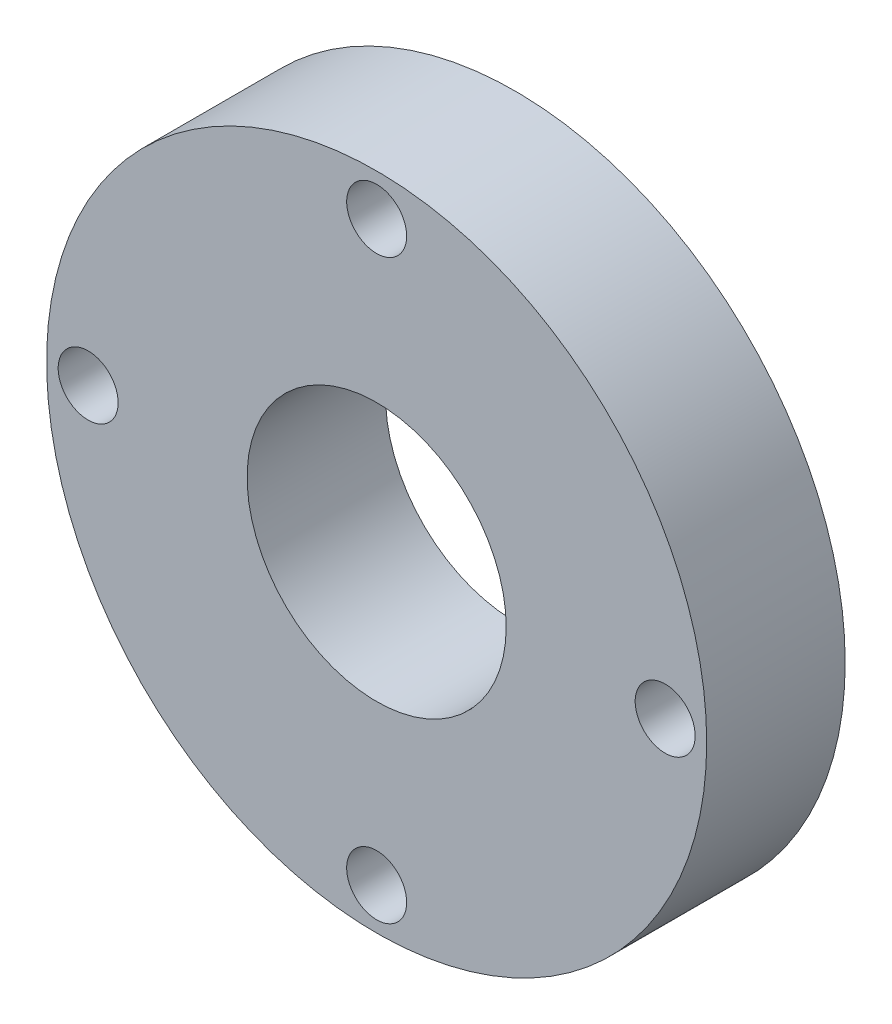
from build123d import *

# Parameters (mm, degrees)
SKETCH1_W            = 15.24
SKETCH1_H            = 26.797
SKETCH5_R            = 14.25575
SEAL_SEAT_DEPTH      = 54.58015461
M6_CLEARANCE_HOLE1_D = 6.6
CIRPATTERN1_COUNT    = 4


with BuildPart() as part:
    # Sketch1 → Main_body (revolve)
    with BuildSketch(Plane(origin=(0, 0, 0), x_dir=(0, 0, -1), z_dir=(1, 0, 0))):
        with Locations((-127.089000076, 22.9235)):
            Rectangle(SKETCH1_W, SKETCH1_H)
    revolve(axis=Axis((0, 0, 1000), (0, 0, -1)))

    # Sketch5 → seal_seat (cut, through all)
    with BuildSketch(Plane.XY.offset(134.709000076)):
        Circle(SKETCH5_R)
    extrude(amount=-SEAL_SEAT_DEPTH, mode=Mode.SUBTRACT)

    # M6 Clearance Hole1 (through all)
    with Locations(Plane.XY.offset(134.709000076)):
        with Locations((0, 31.75)):
            m6_clearance_hole1 = Hole(M6_CLEARANCE_HOLE1_D / 2)

    # CirPattern1: M6 Clearance Hole1 ×4 about axis
    cirpattern1_axis = Axis((0, 0, 1000), (0, 0, -1))
    for i in range(1, CIRPATTERN1_COUNT):
        add(m6_clearance_hole1.rotate(cirpattern1_axis, i * 360 / CIRPATTERN1_COUNT), mode=Mode.SUBTRACT)


solid = part.part
